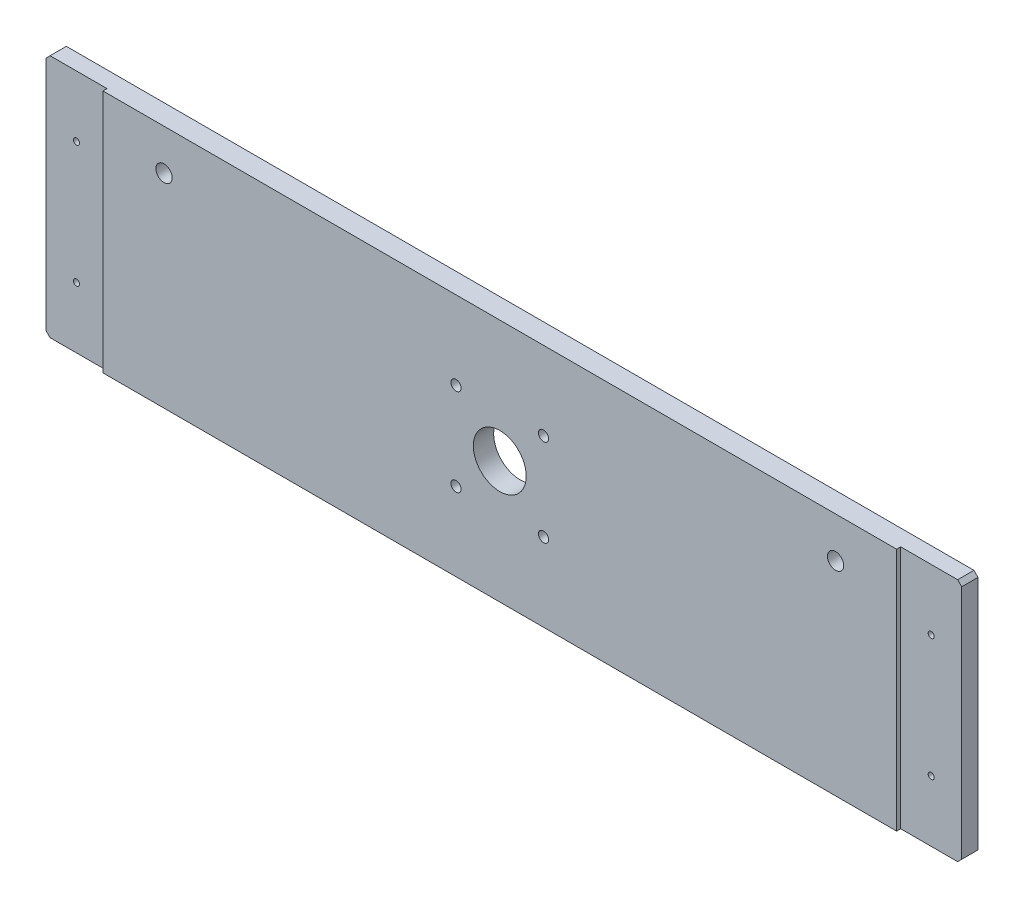
from build123d import *

# Parameters (mm, degrees)
SCHIZZO1_R                   = 13
SCHIZZO1_R_2                 = 4
SCHIZZO1_R_3                 = 1.5
SCHIZZO1_R_4                 = 2.5
ESTRUSIONE_ESTRUSIONE1_DEPTH = 10
SCHIZZO2_W                   = 30
SCHIZZO2_H                   = 120
TAGLIO_ESTRUSIONE1_DEPTH     = 2


with BuildPart() as part:
    # Schizzo1 → Estrusione-Estrusione1 (new body)
    with BuildSketch(Plane.XY):
        Polygon((2, 0), (448, 0), (450, 2), (450, 118), (448, 120), (2, 120), (0, 118), (0, 2), align=None)
        with Locations((225, 60)):
            Circle(SCHIZZO1_R, mode=Mode.SUBTRACT)
        with Locations((390, 100)):
            Circle(SCHIZZO1_R_2, mode=Mode.SUBTRACT)
        with Locations((60, 100)):
            Circle(SCHIZZO1_R_2, mode=Mode.SUBTRACT)
        with Locations((15, 30)):
            Circle(SCHIZZO1_R_3, mode=Mode.SUBTRACT)
        with Locations((435, 30)):
            Circle(SCHIZZO1_R_3, mode=Mode.SUBTRACT)
        with Locations((203.5, 81.5)):
            Circle(SCHIZZO1_R_4, mode=Mode.SUBTRACT)
        with Locations((246.5, 81.5)):
            Circle(SCHIZZO1_R_4, mode=Mode.SUBTRACT)
        with Locations((246.5, 38.5)):
            Circle(SCHIZZO1_R_4, mode=Mode.SUBTRACT)
        with Locations((203.5, 38.5)):
            Circle(SCHIZZO1_R_4, mode=Mode.SUBTRACT)
        with Locations((435, 90)):
            Circle(SCHIZZO1_R_3, mode=Mode.SUBTRACT)
        with Locations((15, 90)):
            Circle(SCHIZZO1_R_3, mode=Mode.SUBTRACT)
    extrude(amount=-ESTRUSIONE_ESTRUSIONE1_DEPTH)

    # Schizzo2 → Taglio-Estrusione1 (cut)
    with BuildSketch(Plane.XY):
        with Locations((15, 60)):
            Rectangle(SCHIZZO2_W, SCHIZZO2_H)
        with Locations((435, 60)):
            Rectangle(SCHIZZO2_W, SCHIZZO2_H)
    extrude(amount=-TAGLIO_ESTRUSIONE1_DEPTH, mode=Mode.SUBTRACT)


solid = part.part
